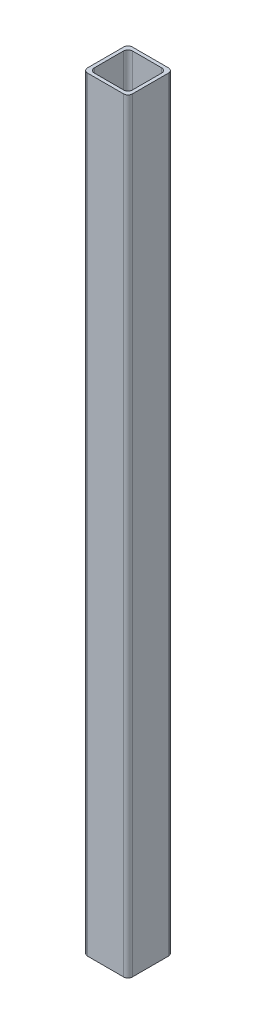
from build123d import *

# Parameters (mm, degrees)
BOSS_EXTRUDE1_DEPTH = 170


with BuildPart() as part:
    # Sketch1 → Boss-Extrude1 (new body)
    with BuildSketch(Plane(origin=(0, 0, 0), x_dir=(1, 0, 0), z_dir=(0, 1, 0))):
        with BuildLine():
            Line((-4, -5), (4, -5))
            ThreePointArc((4, -5), (4.707106781, -4.707106781), (5, -4))
            Line((5, -4), (5, 4))
            ThreePointArc((5, 4), (4.707106781, 4.707106781), (4, 5))
            Line((4, 5), (-4, 5))
            ThreePointArc((-4, 5), (-4.707106781, 4.707106781), (-5, 4))
            Line((-5, 4), (-5, -4))
            ThreePointArc((-5, -4), (-4.707106781, -4.707106781), (-4, -5))
        make_face()
        with BuildLine():
            Line((-3.25, -4.25), (3.25, -4.25))
            ThreePointArc((3.25, -4.25), (3.957106781, -3.957106781), (4.25, -3.25))
            Line((4.25, -3.25), (4.25, 3.25))
            ThreePointArc((4.25, 3.25), (3.957106781, 3.957106781), (3.25, 4.25))
            Line((3.25, 4.25), (-3.25, 4.25))
            ThreePointArc((-3.25, 4.25), (-3.957106781, 3.957106781), (-4.25, 3.25))
            Line((-4.25, 3.25), (-4.25, -3.25))
            ThreePointArc((-4.25, -3.25), (-3.957106781, -3.957106781), (-3.25, -4.25))
        make_face(mode=Mode.SUBTRACT)
    extrude(amount=BOSS_EXTRUDE1_DEPTH)


solid = part.part
